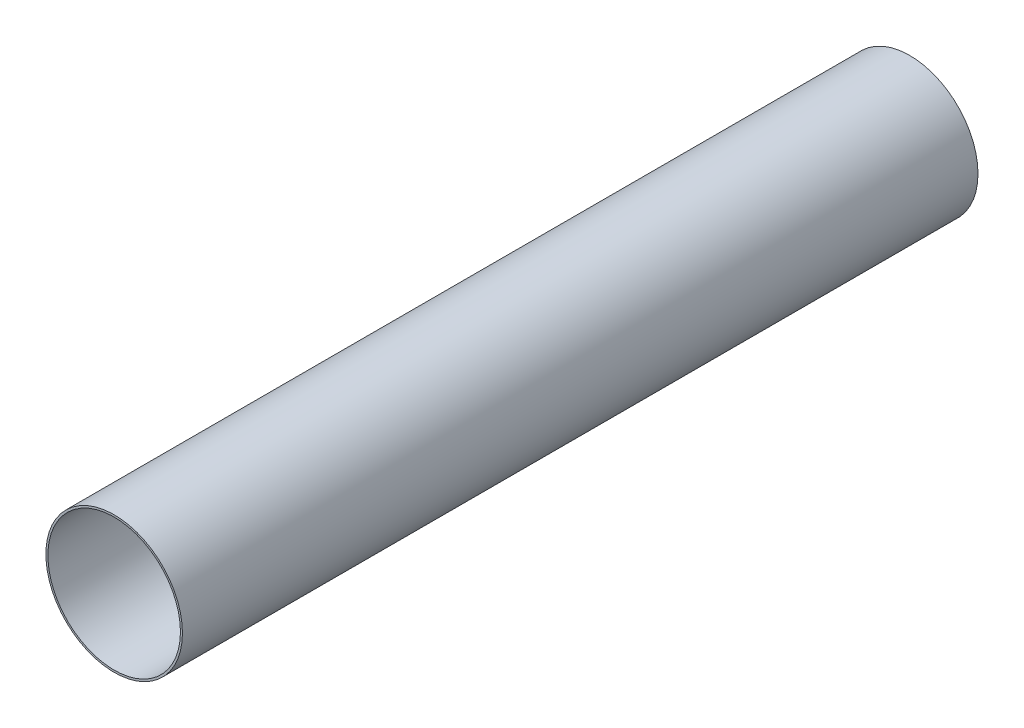
from build123d import *

# Parameters (mm, degrees)
SKETCH1_R           = 65.405
SKETCH1_R_2         = 63.5
BOSS_EXTRUDE1_DEPTH = 381


with BuildPart() as part:
    # Sketch1 → Boss-Extrude1 (new, symmetric)
    with BuildSketch(Plane.XY):
        Circle(SKETCH1_R)
        Circle(SKETCH1_R_2, mode=Mode.SUBTRACT)
    extrude(amount=BOSS_EXTRUDE1_DEPTH, both=True)


solid = part.part
